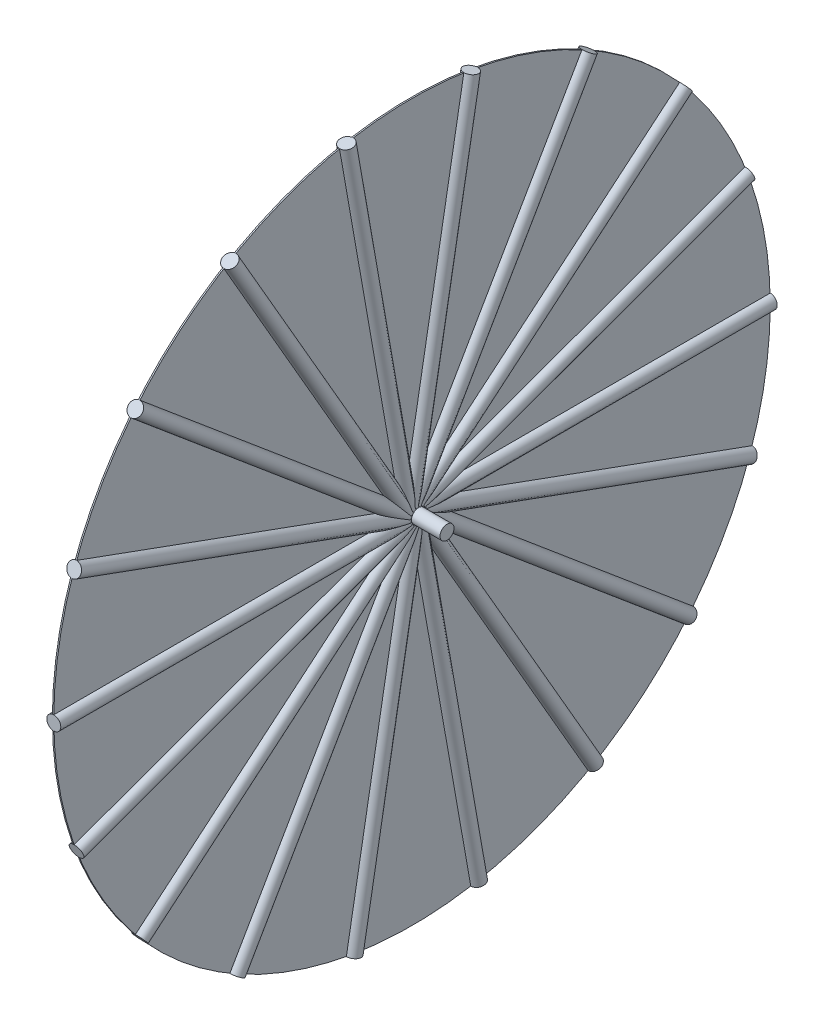
from build123d import *

# Parameters (mm, degrees)
SKETCH3_W           = 127.046882492
SKETCH3_H           = 25.4
SKETCH6_W           = 1274.6
SKETCH6_H           = 25.4
SKETCH7_R           = 1300
BOSS_EXTRUDE2_DEPTH = 5.08
CIRPATTERN1_COUNT   = 18


with BuildPart() as part:
    # Sketch3 → Revolve2 (revolve)
    with BuildSketch(Plane(origin=(39.784286719, 0, 0), x_dir=(1, 0, 0), z_dir=(0, 0, 1))):
        with Locations((63.523441246, 12.7)):
            Rectangle(SKETCH3_W, SKETCH3_H)
    revolve(axis=Axis((39.784286719, 0, 0), (1, 0, 0)))

    # Sketch7 → Boss-Extrude2 (add)
    with BuildSketch(Plane.ZY.offset(-39.784286719)):
        Circle(SKETCH7_R)
    extrude(amount=BOSS_EXTRUDE2_DEPTH)


with BuildPart() as body_2:
    # Sketch6 → Revolve3 (revolve)
    with BuildSketch(Plane.ZY.offset(-39.784286719)):
        with Locations((662.7, 0)):
            Rectangle(SKETCH6_W, SKETCH6_H)
    revolve3 = revolve(axis=Axis((39.784286719, -12.7, 25.4), (0, 0, 1)))

    # CirPattern1: Revolve3 ×18 about axis
    cirpattern1_axis = Axis((34.704286719, 0, 0), (-1, 0, 0))
    for i in range(1, CIRPATTERN1_COUNT):
        add(revolve3.rotate(cirpattern1_axis, i * 360 / CIRPATTERN1_COUNT))


solid = Compound([part.part, body_2.part])
